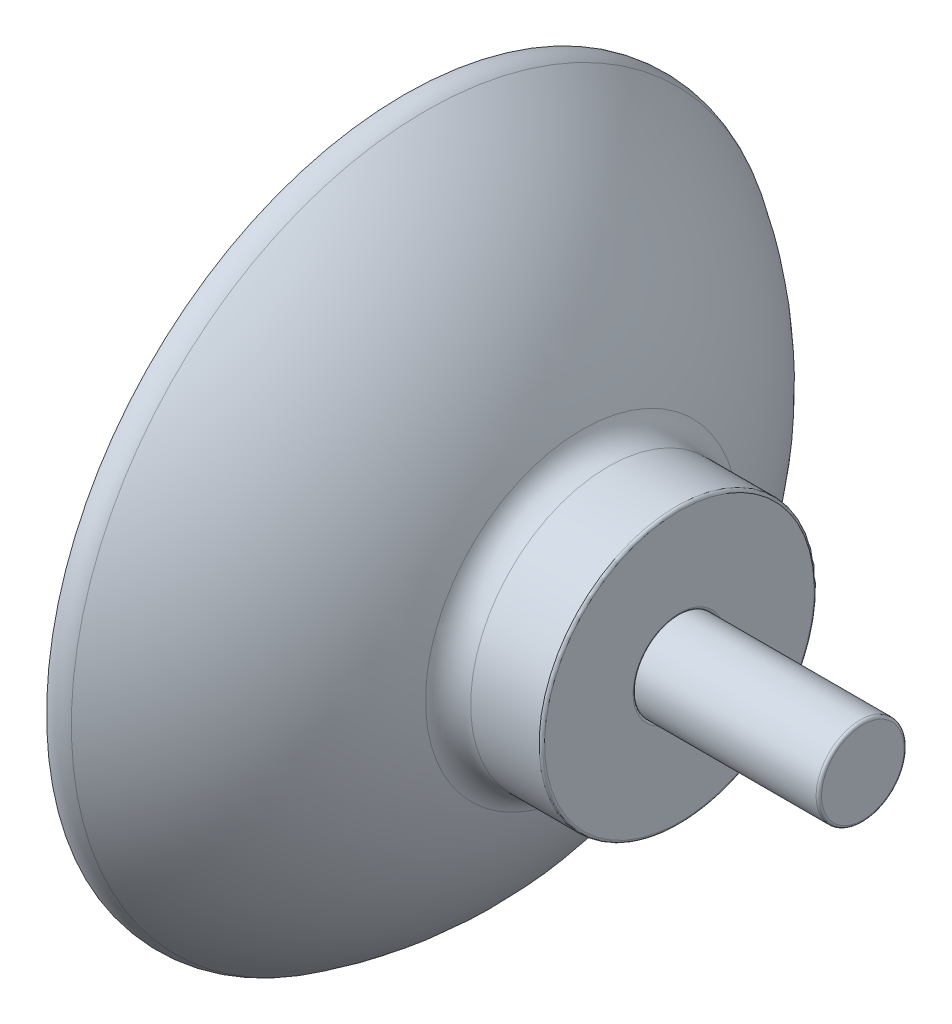
from build123d import *

# Parameters (mm, degrees)
FILLET1_R = 0.15
FILLET2_R = 0.15
FILLET3_R = 1.5
FILLET4_R = 0.15


with BuildPart() as part:
    # Sketch1 → Revolve1 (revolve)
    with BuildSketch(Plane.XY):
        with BuildLine():
            Line((0, 4.000000000000002), (0, 0))
            Line((0, 0), (2, 0))
            Line((2, 0), (2, 4.75))
            Line((2, 4.75), (4, 4.75))
            Line((4, 4.75), (4, 2.375))
            Line((4, 2.375), (5, 2.375))
            Line((5, 2.375), (5, 7.499999999999999))
            Line((5, 7.499999999999999), (0, 7.5))
            ThreePointArc((3.55e-15, 7.499999999999998), (-3.6948542111989937, 14.794116631040804), (-10, 20.000000000000004))
            Line((-10, 20), (-10, 19.5))
            ThreePointArc((-9.999999999999995, 19.500000000000004), (-3.297071481987519, 12.848663560008053), (7.11e-15, 4.000000000000002))
        make_face()
    revolve(axis=Axis((0, 0, 0), (-1, -1.2e-16, 0)))

    # Fillet1
    fillet1_edges = [part.edges().sort_by_distance(p)[0] for p in [
        (5.000000000000002, -7.499999999999997, -9.2e-16),
    ]]
    fillet(fillet1_edges, radius=FILLET1_R)

    # Fillet2
    fillet2_edges = [part.edges().sort_by_distance(p)[0] for p in [
        (5, -2.374999999999999, -2.9e-16),
    ]]
    fillet(fillet2_edges, radius=FILLET2_R)

    # Fillet3
    # the kernel refuses this fillet: 1.5 mm, written as the material it adds along each edge
    with BuildSketch(Plane(origin=(2.69e-15, 0, 0), x_dir=(-1.2e-16, 1, 0), z_dir=(0, 0, 1))) as fillet3_piece_1:
        with BuildLine():
            CenterArc((8.999999999999998, -1.117230925801226), FILLET3_R, 108.1567582497087, 71.84324175029133)
            ThreePointArc((8.532573186973416, 0.3080803294913892), (8.018361800934953, 0.14708482432521733), (7.499999999999998, 0))
            Line((7.499999999999998, 0), (7.499999999999998, -1.117230925801226))
        make_face()
    revolve(axis=Axis((2.69e-15, 0, 0), (-1, -1.2e-16, 0)))
    # the kernel refuses this fillet: 1.5 mm, written as the material it takes off along each edge
    with BuildSketch(Plane(origin=(-9.999999999999998, -1.22e-15, 0), x_dir=(-9e-17, 1, 0), z_dir=(0, 0, 1))) as fillet3_2_piece_1:
        with BuildLine():
            CenterArc((18.05169355974905, -0.3903952550027688), FILLET3_R, 328.36768147729936, 46.71801659257376)
            Line((19.499999999999662, -9.233e-14), (20, 1.78e-15))
            ThreePointArc((20, 1.78e-15), (19.67439153999357, -0.5942328025349539), (19.328840414867702, -1.1770946324402587))
        make_face()
    revolve(axis=Axis((-9.999999999999998, -1.22e-15, 0), (-1, -1.2e-16, 0)), mode=Mode.SUBTRACT)


with BuildPart() as body_2:
    # Sketch2 → Revolve2 (revolve)
    with BuildSketch(Plane(origin=(0, 0, 0), x_dir=(1, 0, 0), z_dir=(0, 1, 0)), mode=Mode.PRIVATE) as revolve2_sk:
        Polygon((2.0000000000000004, 4.7499999999999964), (2.0000000000000004, 0), (15.000000000000004, 2.41e-15), (15.000000000000004, 2.4), (4.000000000000001, 2.399999999999996), (4.000000000000001, 4.7499999999999964), align=None)
    revolve(revolve2_sk.sketch.rotate(Axis((2.0000000000000004, 0, 0), (1, 0, -1.9e-16)), 180), axis=Axis((2.0000000000000004, 0, 0), (1, 0, -1.9e-16)))

    # Fillet4
    fillet4_edges = [body_2.edges().sort_by_distance(p)[0] for p in [
        (15.000000000000005, -5.9e-16, -2.3999999999999995),
    ]]
    fillet(fillet4_edges, radius=FILLET4_R)


solid = Compound([part.part, body_2.part])
